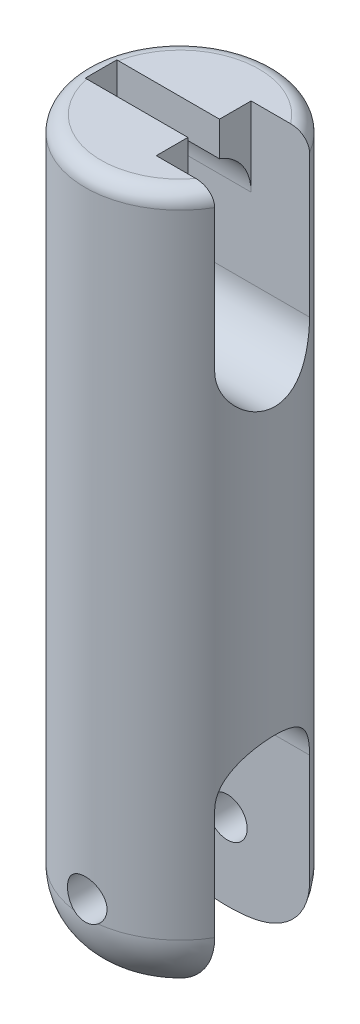
from build123d import *

# Parameters (mm, degrees)
SKETCH1_R               = 6
BOSS_EXTRUDE1_DEPTH     = 45
FILLET1_R               = 1
FILLET2_R               = 4
CUT_EXTRUDE1_DEPTH      = 46.793012581
CUT_EXTRUDE1_DEPTH_BACK = 46.793012581
SKETCH2_R               = 1.25
CUT_EXTRUDE2_DEPTH      = 46.793012598
CUT_EXTRUDE2_DEPTH_BACK = 46.793012598
CUT_EXTRUDE3_DEPTH      = 46.793012598
CUT_EXTRUDE3_DEPTH_BACK = 5
CUT_EXTRUDE4_DEPTH      = 46.793012598
CUT_EXTRUDE4_DEPTH_BACK = 5
CUT_EXTRUDE5_DEPTH      = 10


with BuildPart() as part:
    # Sketch1 → Boss-Extrude1 (new body)
    with BuildSketch(Plane(origin=(0, 0, 0), x_dir=(1, 0, 0), z_dir=(0, 1, 0))):
        Circle(SKETCH1_R)
    extrude(amount=BOSS_EXTRUDE1_DEPTH)

    # Fillet1
    fillet1_edges = [part.edges().sort_by_distance(p)[0] for p in [
        (-6, 45, 0),
    ]]
    fillet(fillet1_edges, radius=FILLET1_R)

    # Fillet2
    fillet2_edges = [part.edges().sort_by_distance(p)[0] for p in [
        (-6, 0, 0),
    ]]
    fillet(fillet2_edges, radius=FILLET2_R)

    # Sketch2 → Cut-Extrude1 (cut, two sides: drawn at the far end of the back side and taken through both)
    with BuildSketch(Plane.XY.offset(-CUT_EXTRUDE1_DEPTH_BACK)):
        with Locations((0, 5)):
            Circle(SKETCH2_R)
    extrude(amount=CUT_EXTRUDE1_DEPTH + CUT_EXTRUDE1_DEPTH_BACK, mode=Mode.SUBTRACT)

    # Sketch3 → Cut-Extrude2 (cut, two sides: drawn at the far end of the back side and taken through both)
    with BuildSketch(Plane(origin=(0, 0, 0), x_dir=(0, 0, -1), z_dir=(1, 0, 0)).offset(-CUT_EXTRUDE2_DEPTH_BACK)):
        with BuildLine():
            Line((-3, 0), (-3, 11))
            ThreePointArc((-3, 11), (0, 14), (3, 11))
            Line((3, 11), (3, 0))
            ThreePointArc((3, 0), (0, -3), (-3, 0))
        make_face()
    extrude(amount=CUT_EXTRUDE2_DEPTH + CUT_EXTRUDE2_DEPTH_BACK, mode=Mode.SUBTRACT)

    # Sketch4 → Cut-Extrude3 (cut, two sides: drawn at the far end of the back side and taken through both)
    with BuildSketch(Plane(origin=(0, 0, 0), x_dir=(0, 0, -1), z_dir=(1, 0, 0)).offset(-CUT_EXTRUDE3_DEPTH_BACK)):
        with BuildLine():
            Line((-3, 35), (-3, 40))
            ThreePointArc((-3, 40), (0, 43), (3, 40))
            Line((3, 40), (3, 35))
            ThreePointArc((3, 35), (0, 32), (-3, 35))
        make_face()
    extrude(amount=CUT_EXTRUDE3_DEPTH + CUT_EXTRUDE3_DEPTH_BACK, mode=Mode.SUBTRACT)

    # Sketch5 → Cut-Extrude4 (cut, two sides: drawn at the far end of the back side and taken through both)
    with BuildSketch(Plane(origin=(0, 0, 0), x_dir=(0, 0, -1), z_dir=(1, 0, 0)).offset(-CUT_EXTRUDE4_DEPTH_BACK)):
        with BuildLine():
            Line((1, 45), (1, 40))
            ThreePointArc((1, 40), (0, 39), (-1, 40))
            Line((-1, 40), (-1, 45))
            ThreePointArc((-1, 45), (0, 46), (1, 45))
        make_face()
    extrude(amount=CUT_EXTRUDE4_DEPTH + CUT_EXTRUDE4_DEPTH_BACK, mode=Mode.SUBTRACT)

    # Sketch6 → Cut-Extrude5 (cut)
    with BuildSketch(Plane(origin=(1.5, 0, 0), x_dir=(0, 0, -1), z_dir=(1, 0, 0))):
        with BuildLine():
            Line((3, 45.000000046), (3, 36.772414369))
            ThreePointArc((3, 36.772414369), (0, 33.772414369), (-3, 36.772414369))
            Line((-3, 36.772414369), (-3, 45.000000046))
            ThreePointArc((-3, 45.000000046), (0, 48.000000046), (3, 45.000000046))
        make_face()
    extrude(amount=CUT_EXTRUDE5_DEPTH, mode=Mode.SUBTRACT)


solid = part.part
